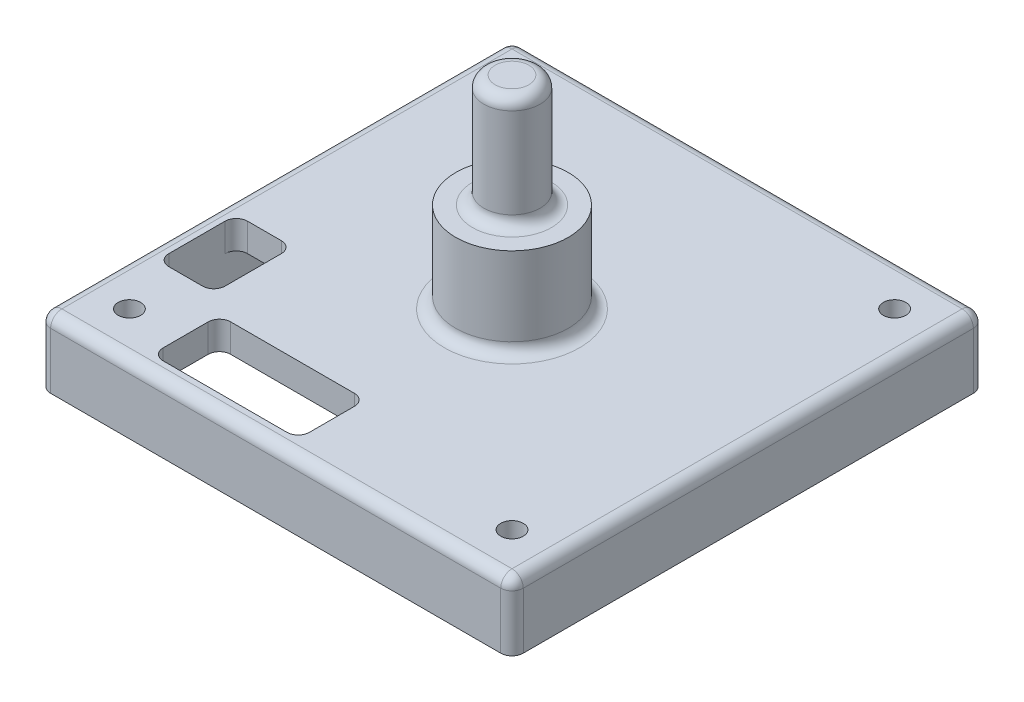
from build123d import *

# Parameters (mm, degrees)
SKETCH1_W           = 42
SKETCH1_H           = 42
BOSS_EXTRUDE1_DEPTH = 6
SKETCH2_W           = 39
SKETCH2_H           = 39
CUT_EXTRUDE1_DEPTH  = 3.5
CUT_EXTRUDE2_REACH  = 31.904
SKETCH3_W           = 5
SKETCH3_H           = 7
SKETCH3_W_2         = 13
SKETCH3_H_2         = 6
BOSS_EXTRUDE2_DEPTH = 2
SKETCH5_R           = 1
CUT_EXTRUDE3_DEPTH  = 31.037476592
SKETCH6_R           = 5
BOSS_EXTRUDE3_DEPTH = 8
SKETCH7_R           = 2.5
BOSS_EXTRUDE4_DEPTH = 10
FILLET1_R           = 1


with BuildPart() as part:
    # Sketch1 → Boss-Extrude1 (new body)
    with BuildSketch(Plane(origin=(0, 0, 0), x_dir=(1, 0, 0), z_dir=(0, 1, 0))):
        Rectangle(SKETCH1_W, SKETCH1_H)
    extrude(amount=BOSS_EXTRUDE1_DEPTH)

    # Sketch2 → Cut-Extrude1 (cut)
    with BuildSketch(Plane.XZ):
        Rectangle(SKETCH2_W, SKETCH2_H)
    extrude(amount=-CUT_EXTRUDE1_DEPTH, mode=Mode.SUBTRACT)

    # Sketch3 → Cut-Extrude2 (cut, up to next)
    with BuildSketch(Plane.XZ.offset(-3.5), mode=Mode.PRIVATE) as cut_extrude2_sk1:
        with Locations((-17, 8.5)):
            Rectangle(SKETCH3_W, SKETCH3_H)
    cut_extrude2_tool1 = extrude(cut_extrude2_sk1.sketch, amount=-CUT_EXTRUDE2_REACH, mode=Mode.PRIVATE) & part.part
    # Sketch3 → Cut-Extrude2 (cut, up to next)
    with BuildSketch(Plane.XZ.offset(-3.5), mode=Mode.PRIVATE) as cut_extrude2_sk2:
        with Locations((-6, 16.5)):
            Rectangle(SKETCH3_W_2, SKETCH3_H_2)
    cut_extrude2_tool2 = extrude(cut_extrude2_sk2.sketch, amount=-CUT_EXTRUDE2_REACH, mode=Mode.PRIVATE) & part.part
    add(cut_extrude2_tool1.solids().sort_by_distance((-17, 3.5, 8.5))[0], mode=Mode.SUBTRACT)
    add(cut_extrude2_tool2.solids().sort_by_distance((-6, 3.5, 16.5))[0], mode=Mode.SUBTRACT)

    # Sketch4 → Boss-Extrude2 (add)
    with BuildSketch(Plane.XZ.offset(-3.5)):
        with BuildLine():
            Line((-19.5, 17), (-19.5, 19.5))
            Line((-19.5, 19.5), (-17, 19.5))
            ThreePointArc((-17, 19.5), (-15.232233047, 15.232233047), (-19.5, 17))
        make_face()
        with BuildLine():
            Line((19.5, 19.5), (17, 19.5))
            ThreePointArc((17, 19.5), (15.232233047, 15.232233047), (19.5, 17))
            Line((19.5, 17), (19.5, 19.5))
        make_face()
        with BuildLine():
            Line((-19.5, -19.5), (-17, -19.5))
            ThreePointArc((-17, -19.5), (-15.232233047, -15.232233047), (-19.5, -17))
            Line((-19.5, -17), (-19.5, -19.5))
        make_face()
        with BuildLine():
            Line((19.5, -17), (19.5, -19.5))
            Line((19.5, -19.5), (17, -19.5))
            ThreePointArc((17, -19.5), (15.232233047, -15.232233047), (19.5, -17))
        make_face()
    extrude(amount=BOSS_EXTRUDE2_DEPTH)

    # Sketch5 → Cut-Extrude3 (cut, through all)
    with BuildSketch(Plane.XZ.offset(-1.5)):
        with Locations((-17, 17)):
            Circle(SKETCH5_R)
        with Locations((17, 17)):
            Circle(SKETCH5_R)
        with Locations((17, -17)):
            Circle(SKETCH5_R)
        with Locations((-17, -17)):
            Circle(SKETCH5_R)
    extrude(amount=-CUT_EXTRUDE3_DEPTH, mode=Mode.SUBTRACT)

    # Sketch6 → Boss-Extrude3 (add)
    with BuildSketch(Plane(origin=(0, 6, 0), x_dir=(1, 0, 0), z_dir=(0, 1, 0))):
        Circle(SKETCH6_R)
    extrude(amount=BOSS_EXTRUDE3_DEPTH)

    # Sketch7 → Boss-Extrude4 (add)
    with BuildSketch(Plane(origin=(0, 14, 0), x_dir=(1, 0, 0), z_dir=(0, 1, 0))):
        Circle(SKETCH7_R)
    extrude(amount=BOSS_EXTRUDE4_DEPTH)

    # Fillet1
    fillet1_edges = [part.edges().sort_by_distance(p)[0] for p in [
        (-2.5, 24, 0),
        (0, 6, -21),
        (-21, 6, 0),
        (0, 6, 21),
        (21, 6, 0),
        (-21, 3, 21),
        (-21, 3, -21),
        (21, 3, -21),
        (21, 3, 21),
        (-12.5, 4.75, 13.5),
        (-12.5, 4.75, 19.5),
        (0.5, 4.75, 19.5),
        (0.5, 4.75, 13.5),
        (-19.5, 4.75, 5),
        (-19.5, 4.75, 12),
        (-14.5, 4.75, 12),
        (-14.5, 4.75, 5),
        (-2.5, 14, 0),
        (-5, 6, 0),
    ]]
    fillet(fillet1_edges, radius=FILLET1_R)


solid = part.part
